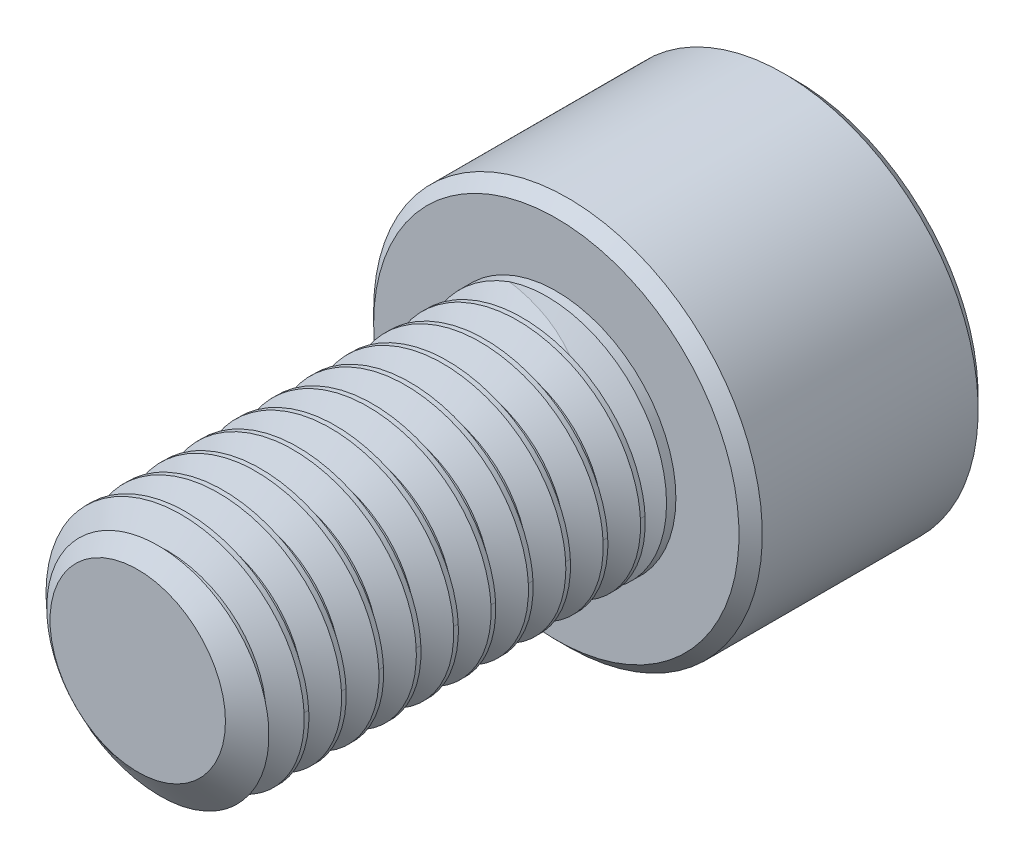
from build123d import *
from build123d.topology import SkipClean

# Parameters (mm, degrees)
SKETCH1_R          = 4
EXTRUDE1_DEPTH     = 14
CUT_SWEEP1_PITCH   = 1.25
SKETCH6_R          = 6.5
EXTRUDE2_DEPTH     = 8
CUT_EXTRUDE1_DEPTH = 4.5
CHAMFER1_SIZE      = 0.39


with BuildPart() as part:
    # Sketch1 → Extrude1 (new body)
    with BuildSketch(Plane.XY):
        Circle(SKETCH1_R)
    extrude(amount=-EXTRUDE1_DEPTH)

    # Cut-Sweep1: the profile of Sketch3 profile screwed along a right-hand helix of 12.2 turns, 6 arcs to a turn; built about Z, then put on its axis
    cut_sweep1_z = Axis((0, 0, 0), (0, 0, 1))
    cut_sweep1_corners = [(4.0003, 0, -1.093923205), (3.188101184, 0, -0.625), (3.188101184, 0, -0.46875), (4.0003, 0, 0.000173205)]
    with BuildLine(mode=Mode.PRIVATE) as cut_sweep1_profile:
        Line(cut_sweep1_corners[0], cut_sweep1_corners[1])
        Line(cut_sweep1_corners[1], cut_sweep1_corners[2])
        Line(cut_sweep1_corners[2], cut_sweep1_corners[3])
        Line(cut_sweep1_corners[3], cut_sweep1_corners[0])
    cut_sweep1_cap = Face(cut_sweep1_profile.wire())
    cut_sweep1_turn_angles = [0, 30, 60, 90, 120, 150, 180, 210, 240, 270, 300, 330, 360]
    cut_sweep1_turn_weights = [1, 0.8660254037844387, 1, 0.8660254037844387, 1, 0.8660254037844387, 1, 0.8660254037844387, 1, 0.8660254037844387, 1, 0.8660254037844387, 1]
    cut_sweep1_turn_rails = [Edge.make_bspline([Vector(p[0], p[1], 0).rotate(cut_sweep1_z, cut_sweep1_turn_angles[k]) / cut_sweep1_turn_weights[k] + Vector(0, 0, p[2] + CUT_SWEEP1_PITCH * cut_sweep1_turn_angles[k] / 360) for k in range(13)], [0, 0, 0, 1, 1, 2, 2, 3, 3, 4, 4, 5, 5, 6, 6, 6], 2, cut_sweep1_turn_weights) for p in cut_sweep1_corners]
    cut_sweep1_turn_sides = [Face.make_surface_from_curves(cut_sweep1_turn_rails[p[0]], cut_sweep1_turn_rails[p[1]]) for p in [(0, 1), (1, 2), (2, 3), (3, 0)]]
    cut_sweep1_last_angles = [4320, 4350, 4380, 4386, 4392]
    cut_sweep1_last_weights = [1, 0.8660254037844387, 1, 0.9945218953682575, 1]
    cut_sweep1_last_rails = [Edge.make_bspline([Vector(p[0], p[1], 0).rotate(cut_sweep1_z, cut_sweep1_last_angles[k]) / cut_sweep1_last_weights[k] + Vector(0, 0, p[2] + CUT_SWEEP1_PITCH * cut_sweep1_last_angles[k] / 360) for k in range(5)], [0, 0, 0, 1, 1, 2, 2, 2], 2, cut_sweep1_last_weights) for p in cut_sweep1_corners]
    cut_sweep1_last_sides = [Face.make_surface_from_curves(cut_sweep1_last_rails[p[0]], cut_sweep1_last_rails[p[1]]) for p in [(0, 1), (1, 2), (2, 3), (3, 0)]]
    cut_sweep1 = Plane(origin=(0, 0, 0), x_dir=(0, 1, 0), z_dir=(0, 0, -1)) * Solid(Shell([*[p.moved(Location((0, 0, CUT_SWEEP1_PITCH * i))) for i in range(12) for p in cut_sweep1_turn_sides], *cut_sweep1_last_sides, cut_sweep1_cap, cut_sweep1_cap.rotate(cut_sweep1_z, 4392).moved(Location((0, 0, CUT_SWEEP1_PITCH * 4392 / 360)))]))
    add(cut_sweep1, mode=Mode.SUBTRACT)

    # Sketch4 → Cut-Revolve1 (revolve, cut)
    with BuildSketch(Plane(origin=(0, 0, 0), x_dir=(0, 0, -1), z_dir=(1, 0, 0)), mode=Mode.PRIVATE) as cut_revolve1_sk:
        Polygon((0.746350386, 4), (0, 2.934101184), (0, 4), align=None)
    revolve(cut_revolve1_sk.sketch.rotate(Axis((0, 0, 0), (0, 0, -1)), 230.713364492), axis=Axis((0, 0, 0), (0, 0, -1)), mode=Mode.SUBTRACT)

    # Sketch6 → Extrude2 (add)
    with BuildSketch(Plane(origin=(0, 0, -14), x_dir=(-1, 0, 0), z_dir=(0, 0, -1))):
        Circle(SKETCH6_R)
    extrude(amount=EXTRUDE2_DEPTH)

    # Sketch7 → Cut-Extrude1 (cut)
    with BuildSketch(Plane(origin=(0, 0, -22), x_dir=(-1, 0, 0), z_dir=(0, 0, -1))):
        Polygon((0, 3.464101615), (-3, 1.732050808), (-3, -1.732050808), (0, -3.464101615), (3, -1.732050808), (3, 1.732050808), align=None)
    extrude(amount=-CUT_EXTRUDE1_DEPTH, mode=Mode.SUBTRACT)

    # Cut-Extrude2 cone 1 section (through the dimple's axis) → Cut-Extrude2 (revolve, cut)
    with BuildSketch(Plane(origin=(0, 0, -22), x_dir=(0, 1, 0), z_dir=(1, 0, 0))):
        Polygon((0, 0), (3.464101615, 0), (0, 3.464101615), align=None)
    revolve(axis=Axis((0, 0, -22), (0, 0, 1)), mode=Mode.SUBTRACT)

    # Chamfer1
    chamfer1_edges = [part.edges().sort_by_distance(p)[0] for p in [
        (6.5, 0, -14),
        (6.5, 0, -22),
    ]]
    chamfer(chamfer1_edges, length=CHAMFER1_SIZE)

    # Sketch10 → Revolve1 (revolve)
    with SkipClean():  # the faces are left unmerged after this step: merging them gives an invalid solid
        with BuildSketch(Plane(origin=(0, 0, 0), x_dir=(0, 0, -1), z_dir=(1, 0, 0)), mode=Mode.PRIVATE) as revolve1_sk:
            Polygon((14, 4), (14, 0), (12.030645751, 0), (13.6875, 4), align=None)
        revolve(revolve1_sk.sketch.rotate(Axis((0, 0, -14), (0, 0, 1)), 270), axis=Axis((0, 0, -14), (0, 0, 1)))


solid = part.part
